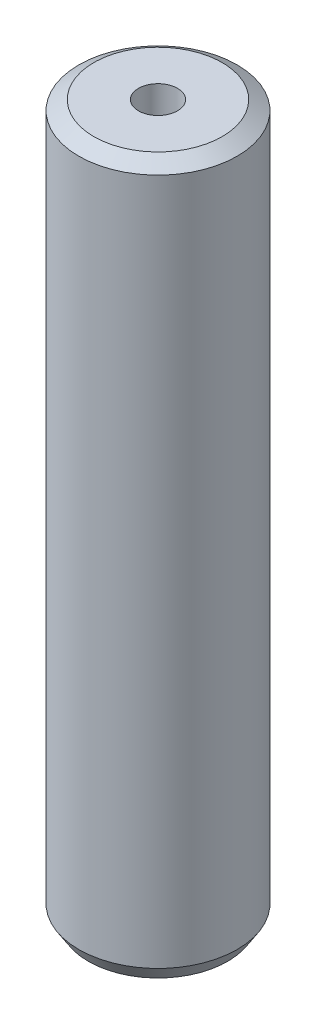
from build123d import *
from OCP.BRepFilletAPI import BRepFilletAPI_MakeChamfer

# Parameters (mm, degrees)
SKETCH1_R           = 7.5
BOSS_EXTRUDE1_DEPTH = 67.40002297
SKETCH2_R           = 1.849620903
CUT_EXTRUDE1_DEPTH  = 69.229488466
CHAMFER1_SIZE       = 0.897357005
CHAMFER1_SIZE2      = 1.420503665


with BuildPart() as part:
    # Sketch1 → Boss-Extrude1 (new body)
    with BuildSketch(Plane(origin=(0, 0, 0), x_dir=(1, 0, 0), z_dir=(0, 1, 0))):
        Circle(SKETCH1_R)
    extrude(amount=BOSS_EXTRUDE1_DEPTH)

    # Sketch2 → Cut-Extrude1 (cut, through all)
    with BuildSketch(Plane(origin=(0, 0, 0), x_dir=(1, 0, 0), z_dir=(0, 1, 0))):
        Circle(SKETCH2_R)
    extrude(amount=CUT_EXTRUDE1_DEPTH, mode=Mode.SUBTRACT)

    # Chamfer1: one chamfer whose edges measure the first distance from different faces: ONE call of the kernel's chamfer builder (chamfer() names one face for all edges)
    chamfer1_edges_1 = [part.edges().sort_by_distance(p)[0] for p in [
        (-7.5, 67.40002297, 0),
    ]]
    chamfer1_side_1 = [part.faces().sort_by_distance(p)[0] for p in [
        (-7.5, 33.700011485, 0),
    ]]
    chamfer1_edges_2 = [part.edges().sort_by_distance(p)[0] for p in [
        (-7.5, 0, 0),
    ]]
    chamfer1_side_2 = [part.faces().sort_by_distance(p)[0] for p in [
        (-7.287867966, 0, 0),
    ]]
    chamfer1 = BRepFilletAPI_MakeChamfer(part.part.solid().wrapped)
    for e in chamfer1_edges_1:
        chamfer1.Add(CHAMFER1_SIZE, CHAMFER1_SIZE2, e.wrapped, chamfer1_side_1[0].wrapped)  # the first distance lies on this face
    for e in chamfer1_edges_2:
        chamfer1.Add(CHAMFER1_SIZE, CHAMFER1_SIZE2, e.wrapped, chamfer1_side_2[0].wrapped)  # the first distance lies on this face
    add(Compound.cast(chamfer1.Shape()), mode=Mode.REPLACE)


solid = part.part
